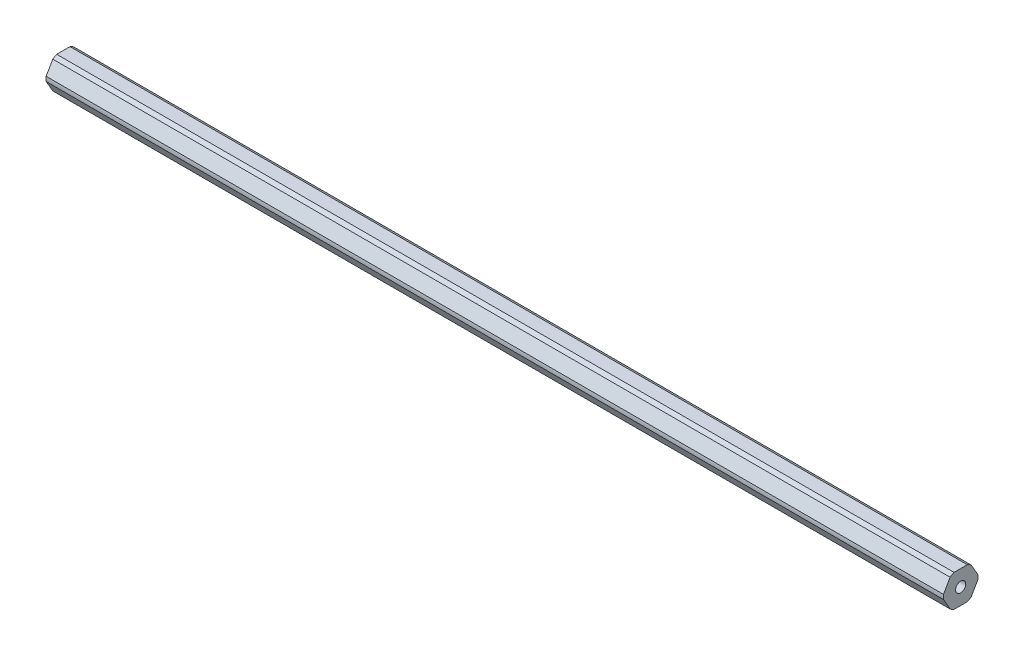
from build123d import *

# Parameters (mm, degrees)
SKETCH1_R                            = 2.0193
BOSS_EXTRUDE1_DEPTH                  = 177.8
F_10_32_TAPPED_HOLE1_D               = 4.0386
F_10_32_TAPPED_HOLE1_DEPTH           = 16.34744
F_10_32_TAPPED_HOLE1_TIP             = 1.213317848
F_10_32_TAPPED_HOLE1_ON_FACE_2_D     = 4.0386
F_10_32_TAPPED_HOLE1_ON_FACE_2_DEPTH = 16.34744
F_10_32_TAPPED_HOLE1_ON_FACE_2_TIP   = 1.213317848


with BuildPart() as part:
    # Sketch1 → Boss-Extrude1 (new, symmetric)
    with BuildSketch(Plane(origin=(0, 0, 0), x_dir=(0, 0, -1), z_dir=(1, 0, 0))):
        with BuildLine():
            ThreePointArc((4.181770846, 5.456960429), (3.437499983, 5.953924622), (2.634980936, 6.35))
            Line((2.634980936, 6.35), (-2.634980936, 6.35))
            ThreePointArc((-2.634980936, 6.35), (-3.437499983, 5.953924622), (-4.181770846, 5.456960429))
            Line((-4.181770846, 5.456960429), (-6.816751782, 0.893039571))
            ThreePointArc((-6.816751782, 0.893039571), (-6.874999966, 0), (-6.816751782, -0.893039571))
            Line((-6.816751782, -0.893039571), (-4.181770846, -5.456960429))
            ThreePointArc((-4.181770846, -5.456960429), (-3.437499983, -5.953924622), (-2.634980936, -6.35))
            Line((-2.634980936, -6.35), (2.634980936, -6.35))
            ThreePointArc((2.634980936, -6.35), (3.437499983, -5.953924622), (4.181770846, -5.456960429))
            Line((4.181770846, -5.456960429), (6.816751782, -0.893039571))
            ThreePointArc((6.816751782, -0.893039571), (6.860422465, -0.447468582), (6.874999966, 0))
            ThreePointArc((6.874999966, 0), (6.860422465, 0.447468582), (6.816751782, 0.893039571))
            Line((6.816751782, 0.893039571), (4.181770846, 5.456960429))
        make_face()
        Circle(SKETCH1_R, mode=Mode.SUBTRACT)
    extrude(amount=BOSS_EXTRUDE1_DEPTH, both=True)

    # #10-32 Tapped Hole1
    with Locations(Plane(origin=(177.8, 0, 0), x_dir=(0, 0, 1), z_dir=(1, 0, 0))):
        with Locations((0, 0)):
            Hole(F_10_32_TAPPED_HOLE1_D / 2, depth=F_10_32_TAPPED_HOLE1_DEPTH)
            with Locations((0, 0, -(F_10_32_TAPPED_HOLE1_DEPTH + F_10_32_TAPPED_HOLE1_TIP / 2))):  # 118° drill point
                Cone(0, F_10_32_TAPPED_HOLE1_D / 2, F_10_32_TAPPED_HOLE1_TIP, mode=Mode.SUBTRACT)

    # #10-32 Tapped Hole1 on face 2
    with Locations(Plane(origin=(-177.8, 0, 0), x_dir=(0, 0, 1), z_dir=(1, 0, 0))):
        with Locations((0, 0)):
            Hole(F_10_32_TAPPED_HOLE1_ON_FACE_2_D / 2, depth=F_10_32_TAPPED_HOLE1_ON_FACE_2_DEPTH)
            with Locations((0, 0, -(F_10_32_TAPPED_HOLE1_ON_FACE_2_DEPTH + F_10_32_TAPPED_HOLE1_ON_FACE_2_TIP / 2))):  # 118° drill point
                Cone(0, F_10_32_TAPPED_HOLE1_ON_FACE_2_D / 2, F_10_32_TAPPED_HOLE1_ON_FACE_2_TIP, mode=Mode.SUBTRACT)


solid = part.part
